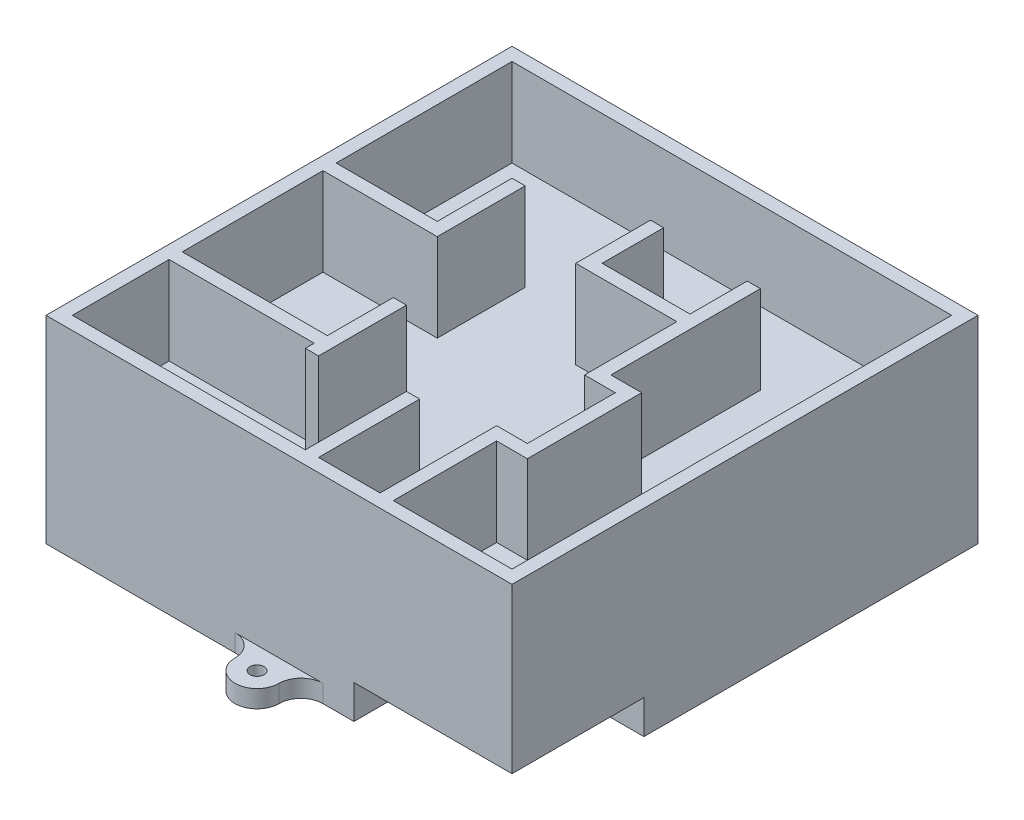
from build123d import *

# Parameters (mm, degrees)
SKETCH2_W           = 106
SKETCH2_H           = 106
SKETCH2_R           = 4
SKETCH2_R_2         = 6
BOSS_EXTRUDE1_DEPTH = 25
SKETCH3_W           = 106
SKETCH3_H           = 106
SKETCH3_W_2         = 100
SKETCH3_H_2         = 100
BOSS_EXTRUDE2_DEPTH = 20
SKETCH5_W           = 3
SKETCH5_H           = 23
BOSS_EXTRUDE3_DEPTH = 20
SKETCH7_W           = 20
SKETCH7_H           = 3
BOSS_EXTRUDE4_DEPTH = 20
SKETCH9_R           = 9.905763918
CUT_EXTRUDE1_DEPTH  = 10
SKETCH10_W          = 10
SKETCH10_H          = 4
BOSS_EXTRUDE5_DEPTH = 10
SKETCH11_W          = 10
SKETCH11_H          = 4
BOSS_EXTRUDE6_DEPTH = 10
FILLET2_RADIUS      = 5
FILLET2_LENGTH      = 4
FILLET3_R           = 5
FILLET4_R           = 5
FILLET5_R           = 5
SKETCH13_R          = 1.6
CUT_EXTRUDE2_DEPTH  = 163.397660082
SKETCH14_W          = 35.96051594
SKETCH14_H          = 7.693498276
CUT_EXTRUDE3_DEPTH  = 30


with BuildPart() as part:
    # Sketch2 → Boss-Extrude1 (new body)
    with BuildSketch(Plane(origin=(0, 0, 0), x_dir=(1, 0, 0), z_dir=(0, 1, 0))):
        with Locations((53, 53)):
            Rectangle(SKETCH2_W, SKETCH2_H)
        with Locations(Location((18, 15, 0), (0, 0, 270))):
            Circle(SKETCH2_R, mode=Mode.SUBTRACT)
        with Locations(Location((92, 13.5, 0), (0, 0, 270))):
            Circle(SKETCH2_R_2, mode=Mode.SUBTRACT)
    extrude(amount=BOSS_EXTRUDE1_DEPTH)

    # Sketch3 → Boss-Extrude2 (add)
    with BuildSketch(Plane(origin=(0, 25, 0), x_dir=(1, 0, 0), z_dir=(0, 1, 0))):
        with Locations((53, 53)):
            Rectangle(SKETCH3_W, SKETCH3_H)
        with Locations((53, 53)):
            Rectangle(SKETCH3_W_2, SKETCH3_H_2, mode=Mode.SUBTRACT)
    extrude(amount=BOSS_EXTRUDE2_DEPTH)

    # Sketch5 → Boss-Extrude3 (add)
    with BuildSketch(Plane(origin=(0, 25, 0), x_dir=(1, 0, 0), z_dir=(0, 1, 0))):
        Polygon((3, 28), (3, 25), (36, 25), (36, 23), (39, 23), (39, 43), (36, 43), (36, 28), align=None)
        Polygon((83, 52.5), (83, 26.5), (76, 26.5), (76, 3), (73, 3), (73, 29.5), (80, 29.5), (80, 49.5), (73, 49.5), (73, 52.5), align=None)
        Polygon((3, 63), (3, 60), (29, 60), (29, 80), (26, 80), (26, 63), align=None)
        with Locations((57.5, 14.5)):
            Rectangle(SKETCH5_W, SKETCH5_H)
    extrude(amount=BOSS_EXTRUDE3_DEPTH)

    # Sketch7 → Boss-Extrude4 (add)
    with BuildSketch(Plane(origin=(0, 25, 0), x_dir=(1, 0, 0), z_dir=(0, 1, 0))):
        Polygon((50, 70.496538655), (53, 70.496538655), (53, 73.496538655), (53, 87.496538655), (50, 87.496538655), align=None)
        with Locations((63, 71.996538655)):
            Rectangle(SKETCH7_W, SKETCH7_H)
        Polygon((73, 70.496538655), (73, 52.5), (76, 52.5), (76, 86.5), (73, 86.5), (73, 73.496538655), align=None)
    extrude(amount=BOSS_EXTRUDE4_DEPTH)

    # Sketch9 → Cut-Extrude1 (cut)
    with BuildSketch(Plane(origin=(0, 25, 0), x_dir=(1, 0, 0), z_dir=(0, 1, 0))):
        with Locations(Location((92, 13.5, 0), (0, 0, 270))):
            Circle(SKETCH9_R)
    extrude(amount=-CUT_EXTRUDE1_DEPTH, mode=Mode.SUBTRACT)

    # Sketch10 → Boss-Extrude5 (add)
    with BuildSketch(Plane.XY):
        with Locations((53, 2)):
            Rectangle(SKETCH10_W, SKETCH10_H)
    extrude(amount=BOSS_EXTRUDE5_DEPTH)

    # Sketch11 → Boss-Extrude6 (add)
    with BuildSketch(Plane(origin=(0, 0, -106), x_dir=(-1, 0, 0), z_dir=(0, 0, -1))):
        with Locations((-53, 2)):
            Rectangle(SKETCH11_W, SKETCH11_H)
    extrude(amount=BOSS_EXTRUDE6_DEPTH)

    # Fillet2: full round fillet: the end face becomes a half cylinder, R = half its width
    fillet2_face = Plane((53, 2, -116), x_dir=(0, -1, 0), z_dir=(0, 0, -1))  # on the end face: x along it, z out of the body
    fillet2_slab = fillet2_face.offset(-FILLET2_RADIUS / 2) * Box(FILLET2_LENGTH, 2 * FILLET2_RADIUS, FILLET2_RADIUS, mode=Mode.PRIVATE)  # the body's end, R deep
    fillet2_round = Plane((53, 2, -111), x_dir=(0, 0, -1), z_dir=(0, -1, 0)) * Cylinder(FILLET2_RADIUS, FILLET2_LENGTH, mode=Mode.PRIVATE)  # its axis R under the face
    add(fillet2_slab - fillet2_round, mode=Mode.SUBTRACT)

    # Fillet3
    fillet3_edges = [part.edges().sort_by_distance(p)[0] for p in [
        (48, 2, -106),
        (58, 2, -106),
    ]]
    fillet(fillet3_edges, radius=FILLET3_R - 0.0001)  # a hair under: the kernel refuses the full size

    # Fillet4
    fillet4_edges = [part.edges().sort_by_distance(p)[0] for p in [
        (48, 2, 0),
        (58, 2, 0),
    ]]
    fillet(fillet4_edges, radius=FILLET4_R)

    # Fillet5
    fillet5_edges = [part.edges().sort_by_distance(p)[0] for p in [
        (48, 2, 10),
        (58, 2, 10),
    ]]
    fillet(fillet5_edges, radius=FILLET5_R - 0.0001)  # a hair under: the kernel refuses the full size

    # Sketch13 → Cut-Extrude2 (cut, through all)
    with BuildSketch(Plane(origin=(0, 4, 0), x_dir=(1, 0, 0), z_dir=(0, 1, 0))):
        with Locations(Location((53, -5, 0), (0, 0, 180))):
            Circle(SKETCH13_R)
        with Locations(Location((53, 111, 0), (0, 0, 180))):
            Circle(SKETCH13_R)
    extrude(amount=-CUT_EXTRUDE2_DEPTH, mode=Mode.SUBTRACT)

    # Sketch14 → Cut-Extrude3 (cut)
    with BuildSketch(Plane.XY):
        with Locations((88.01974203, 3.846749138)):
            Rectangle(SKETCH14_W, SKETCH14_H)
    extrude(amount=-CUT_EXTRUDE3_DEPTH, mode=Mode.SUBTRACT)


solid = part.part
